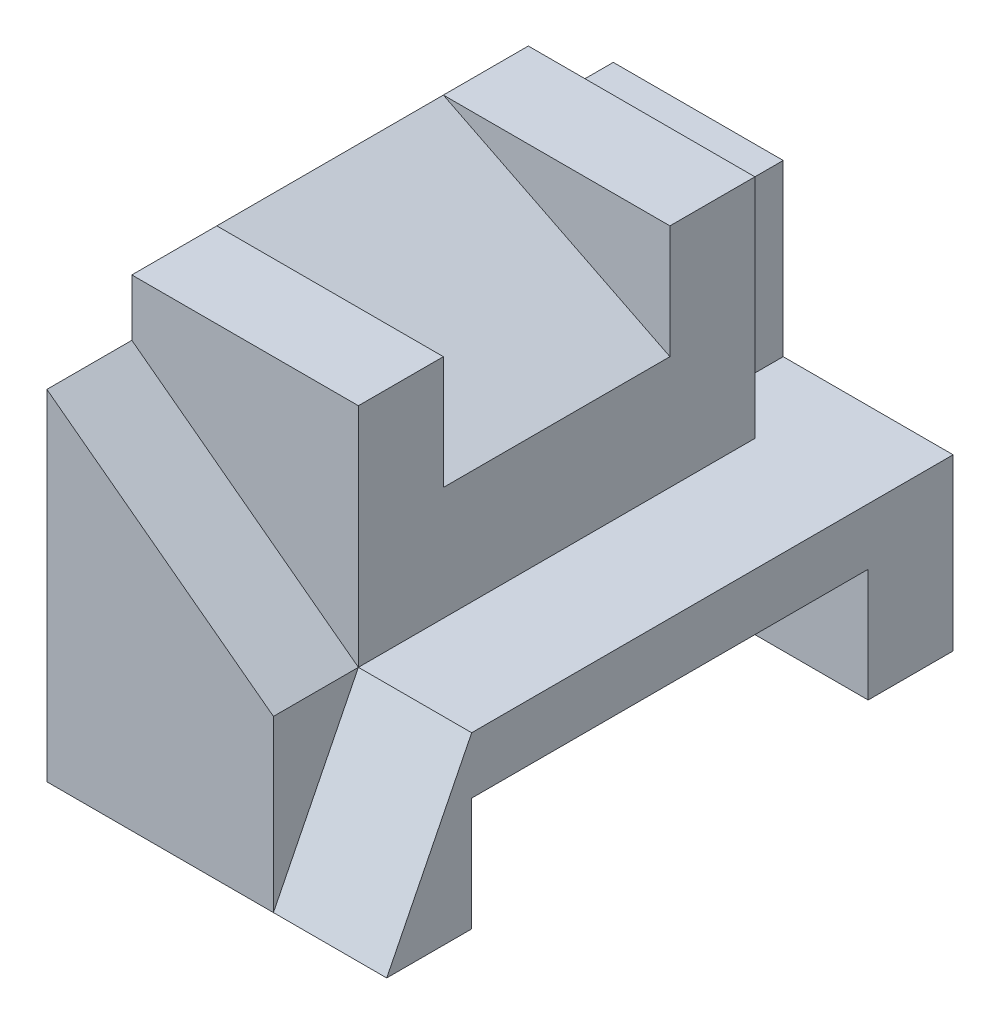
from build123d import *

# Parameters (mm, degrees)
SALIENTE_EXTRUIR1_DEPTH = 2
CHAFL_N2_SIZE           = 3
CHAFL_N2_SIZE_2         = 1.5
SALIENTE_EXTRUIR2_DEPTH = 4
CROQUIS3_W              = 4
CROQUIS3_H              = 1.5
SALIENTE_EXTRUIR3_DEPTH = 3
CHAFL_N3_SIZE2          = 3
CHAFL_N3_SIZE           = 4
SALIENTE_EXTRUIR4_DEPTH = 4
CROQUIS5_W              = 4
CROQUIS5_H              = 4
SALIENTE_EXTRUIR5_DEPTH = 2
CHAFL_N4_SIZE           = 2
CHAFL_N4_SIZE_2         = 4
CROQUIS6_W              = 3
CROQUIS6_H              = 1.5
SALIENTE_EXTRUIR6_DEPTH = 3


# Some blends are built 0.0001 mm under size
with BuildPart() as part:
    # Croquis1 → Saliente-Extruir1 (new body)
    with BuildSketch(Plane(origin=(0, 0, 0), x_dir=(0, 0, -1), z_dir=(1, 0, 0))):
        Polygon((0, 0), (0, 2), (-7, 2), (-7, 0), (-8.5, 0), (-8.5, 3), (1.5, 3), (1.5, 0), align=None)
    extrude(amount=-SALIENTE_EXTRUIR1_DEPTH)

    # Chaflán2
    # the kernel refuses this chamfer: 3, 1.5 mm, written as the material it takes off along each edge
    with BuildSketch(Plane(origin=(7.769486621, 3, 8.5), x_dir=(0, -0.9998508956747117, 0.017268075123667865), z_dir=(-1, 0, 0))) as chafl_n2_piece_1:
        Polygon((CHAFL_N2_SIZE * 0.999850895675, -CHAFL_N2_SIZE * 0.0172680751237), (-CHAFL_N2_SIZE_2 * 0.0172680751237, -CHAFL_N2_SIZE_2 * 0.999850895675), (0, 0), align=None)
    extrude(amount=17.538973243, mode=Mode.SUBTRACT)

    # Croquis2 → Saliente-Extruir2 (add)
    with BuildSketch(Plane.ZY.offset(2)):
        Polygon((7, 3), (8.5, 3), (8.5, 0), (7, 0), (7, 2), (0, 2), (0, 0), (-1.5, 0), (-1.5, 3), align=None)
    extrude(amount=SALIENTE_EXTRUIR2_DEPTH)

    # Croquis3 → Saliente-Extruir3 (add)
    with BuildSketch(Plane(origin=(0, 3, 0), x_dir=(1, 0, 0), z_dir=(0, 1, 0))):
        with Locations((-4, -7.75)):
            Rectangle(CROQUIS3_W, CROQUIS3_H)
    extrude(amount=SALIENTE_EXTRUIR3_DEPTH)

    # Chaflán3
    chafl_n3_edges = [part.edges().sort_by_distance(p)[0] for p in [
        (-2, 6, 7.75),
    ]]
    chafl_n3_side = [part.faces().sort_by_distance(p)[0] for p in [
        (-2.06, 6, 7.75),
    ]]
    chamfer(chafl_n3_edges, length=CHAFL_N3_SIZE - 0.0001, length2=CHAFL_N3_SIZE2 - 0.0001, reference=chafl_n3_side[0])  # a hair under: the kernel refuses the full size

    # Croquis4 → Saliente-Extruir4 (add)
    with BuildSketch(Plane(origin=(-2, 0, 0), x_dir=(0, 0, -1), z_dir=(1, 0, 0))):
        Polygon((-7, 3), (0, 3), (0, 7), (-1.5, 7), (-1.5, 5), (-5.5, 5), (-5.5, 7), (-7, 7), align=None)
    extrude(amount=-SALIENTE_EXTRUIR4_DEPTH)

    # Croquis6 → Saliente-Extruir6 (add)
    with BuildSketch(Plane(origin=(0, 3, 0), x_dir=(1, 0, 0), z_dir=(0, 1, 0))):
        with Locations((-4.5, 0.75)):
            Rectangle(CROQUIS6_W, CROQUIS6_H)
    extrude(amount=SALIENTE_EXTRUIR6_DEPTH)


with BuildPart() as body_2:
    # Croquis5 → Saliente-Extruir5 (new body)
    with BuildSketch(Plane(origin=(0, 5, 0), x_dir=(1, 0, 0), z_dir=(0, 1, 0))):
        with Locations((-4, -3.5)):
            Rectangle(CROQUIS5_W, CROQUIS5_H)
    extrude(amount=SALIENTE_EXTRUIR5_DEPTH)

    # Chaflán4
    # the kernel refuses this chamfer: 4, 2 mm, written as the material it takes off along each edge
    with BuildSketch(Plane(origin=(-2, 7, 15.859315495), x_dir=(0.06891834360170881, -0.9976223042390326, 0), z_dir=(0, 0, -1))) as chafl_n4_piece_1:
        Polygon((CHAFL_N4_SIZE * 0.997622304239, CHAFL_N4_SIZE * 0.0689183436017), (-CHAFL_N4_SIZE_2 * 0.0689183436017, CHAFL_N4_SIZE_2 * 0.997622304239), (0, 0), align=None)
    extrude(amount=24.71863099, mode=Mode.SUBTRACT)


solid = Compound([part.part, body_2.part])
